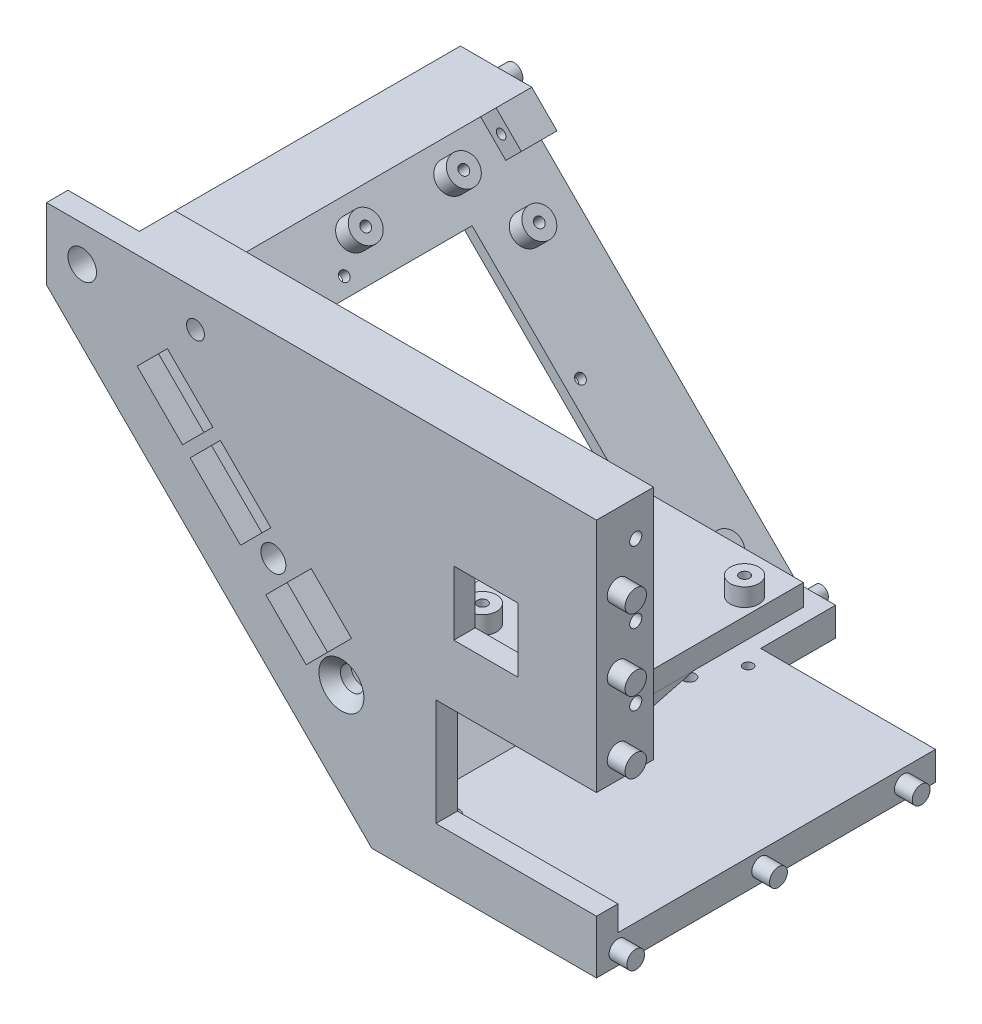
from build123d import *

# Parameters (mm, degrees)
TOP_EXTRUSION_DEPTH                            = 6
MOTHERBOARD_HOLE_SKETCH_W                      = 45
MOTHERBOARD_HOLE_SKETCH_H                      = 30
MOTHERBOARD_HOLE_DEPTH                         = 191.138226036
TOP_HOLES_SKETCH_R                             = 3.5
TOP_HOLES_DEPTH                                = 6
TOP_LEFT_HOLE_SKETCH_R                         = 4
TOP_LEFT_HOLE_DEPTH                            = 191.138226036
VERTICAL_FACE_10MM_EXTRUSION_DEPTH             = 10
FRAISAGE_POUR_VIS_T_TE_FRAIS_E_M31_D           = 3.4
FRAISAGE_POUR_VIS_T_TE_FRAIS_E_M31_DEPTH       = 8
FRAISAGE_POUR_VIS_T_TE_FRAIS_E_M31_CSINK_D     = 6.3
FRAISAGE_POUR_VIS_T_TE_FRAIS_E_M31_CSINK_ANGLE = 90
FIX_SCREW_LINEAR_REPETITION_COUNT              = 3
FIX_SCREW_LINEAR_REPETITION_PITCH              = 20
LEFT_RIGHT_FIX_SKETCH_R                        = 3
LEFT_RIGHT_FIX_SKETCH_R_2                      = 2.5
LEFT_RIGHT_FIX_EXTRUSION_DEPTH                 = 5
FIX_USBBOARD_SKETCH_W                          = 46
FIX_USBBOARD_SKETCH_H                          = 6
FIX_USBBOARD_EXTRUSION_DEPTH                   = 60
USBCONNECTOR_HOLE_SKETCH_W                     = 18
USBCONNECTOR_HOLE_SKETCH_H                     = 18
USBCONNECTOR_HOLE_DEPTH                        = 6
FIX_SCREW_USBBOARD_SKETCH_R                    = 4
FIX_SCREW_USBBOARD_EXTRUSION_DEPTH             = 5
FIX_SCREW_USBBOARD_HOLE_SKETCH_R               = 1.4
FIX_SCREW_USBBOARD_HOLE_DEPTH                  = 11
CONSOLIDATION_EXTRUSION_DEPTH                  = 37
VERTICAL_FACE_EXTRUSION_DEPTH                  = 100
LEFT_VERTICAL_HOLE_SKETCH_W                    = 71
LEFT_VERTICAL_HOLE_SKETCH_H                    = 76.90556621
LEFT_VERTICAL_HOLE_DEPTH                       = 8
LEFT_VERTICAL_GLASS_SKETCH_W                   = 87
LEFT_VERTICAL_GLASS_SKETCH_H                   = 92.90556621
LEFT_VERTICAL_GLASS_HOLE_DEPTH                 = 5
LEFT_VERTICAL_GLASS_FIX_HOLE_SKETCH_R          = 1.35
LEFT_VERTICAL_GLASS_FIX_HOLE_DEPTH             = 3
BOTTOM_FIX_SKETCH_R                            = 2.5
BOTTOM_FIX_SKETCH_R_2                          = 2
BOTTOM_FIX_EXTRUSION_DEPTH                     = 5
BOTTOM_FIX_SCREW_SKETCH_W                      = 10
BOTTOM_FIX_SCREW_SKETCH_H                      = 10
BOTTOM_FIX_SCREW_EXTRUSION_DEPTH               = 6.142136
BOTTOM_FIX_SCREW_HOLE_SKETCH_R                 = 1.35
BOTTOM_FIX_SCREW_HOLE_DEPTH                    = 10
LCDHOLE_SKETCH_W                               = 49
LCDHOLE_SKETCH_H                               = 42
LCDHOLE_DEPTH                                  = 8
LCDSCREW_R                                     = 1.35
LCDSCREW_HOLE_DEPTH                            = 7
ELECTRONICALMAINBOARDFIX_SKETCH_R              = 4
ELECTRONICALMAINBOARDFIX_EXTRUSION_DEPTH       = 5
ELECTRONICALMAINBOARDFIX_HOLE_SKETCH_R         = 1.35
ELECTRONICALMAINBOARDFIX_HOLE_DEPTH            = 7
SCREW_MOTHERBOARDFIX_LINEAR_REPEAT_COUNT       = 2
SCREW_MOTHERBOARDFIX_LINEAR_REPEAT_PITCH       = 66
LEFTFIX_HOLE_REACH                             = 200.399
RIGHTFIX_HOLE_START                            = -16.75
RIGHTFIX_HOLE_DEPTH                            = 16.75
RIGHTFIX_HOLE_START_2                          = -94.978995736
RIGHTFIX_HOLE_2_DEPTH                          = 3.978995736


with BuildPart() as part:
    # Top Sketch → Top-Extrusion (new body)
    with BuildSketch(Plane.XY):
        Polygon((-63, 0), (0, 0), (0, 111.15), (-154.15, 111.15), (-154.15, 91.15), align=None)
    extrude(amount=TOP_EXTRUSION_DEPTH)

    # MotherBoard-Hole-Sketch → MotherBoard-Hole (cut, through all)
    with BuildSketch(Plane.XY.offset(6)):
        with Locations((-22.5, 30)):
            Rectangle(MOTHERBOARD_HOLE_SKETCH_W, MOTHERBOARD_HOLE_SKETCH_H)
    extrude(amount=-MOTHERBOARD_HOLE_DEPTH, mode=Mode.SUBTRACT)

    # Top-Holes-Sketch → Top-Holes (cut)
    with BuildSketch(Plane.XY.offset(6)):
        with Locations((-90.577164466, 56.568542495)):
            Circle(TOP_HOLES_SKETCH_R)
        Polygon((-120.275649276, 92.630988335), (-128.76093065, 84.145706961), (-116.033008589, 71.4177849), (-107.547727215, 79.903066274), align=None)
        Polygon((-113.911688245, 69.296464556), (-99.769552622, 55.154328933), (-91.284271247, 63.639610307), (-105.426406871, 77.781745931), align=None)
        Polygon((-79.970562748, 59.39696962), (-92.69848481, 46.669047558), (-81.384776311, 35.355339059), (-68.656854249, 48.083261121), align=None)
    extrude(amount=-TOP_HOLES_DEPTH, mode=Mode.SUBTRACT)

    # Esquisse20 → Fraisage pour vis à tête fraisée M61 (revolve, cut)
    with BuildSketch(Plane(origin=(-71.5, 35.370057685, 6), x_dir=(0, -1, 0), z_dir=(1, 0, 0))):
        Polygon((0, 0), (0, 6), (3.3, 6), (3.3, 3), (6.3, 0), align=None)
    revolve(axis=Axis((-71.5, 35.370057685, 12.35), (0, 0, -1)), mode=Mode.SUBTRACT)

    # Top-Left-Hole-Sketch → Top-Left-Hole (cut, through all)
    with BuildSketch(Plane.XY.offset(6)):
        with Locations((-144.15, 101.15)):
            Circle(TOP_LEFT_HOLE_SKETCH_R)
    extrude(amount=-TOP_LEFT_HOLE_DEPTH, mode=Mode.SUBTRACT)

    # Vertical-Face-10mm-Sketch → Vertical-Face-10mm-Extrusion (add)
    with BuildSketch(Plane(origin=(0, 0, 0), x_dir=(-1, 0, 0), z_dir=(0, 0, -1))):
        Polygon((90.65, 105.15), (90.65, 91.15), (128.694155877, 91.15), (135.765223689, 84.078932188), (59.686291501, 8), (0, 8), (0, 0), (63, 0), (154.15, 91.15), (134.15, 91.15), (134.15, 111.15), (115.306380703, 111.15), (0, 111.15), (0, 45), (45, 45), (45, 53), (8, 53), (8, 105.15), align=None)
    extrude(amount=VERTICAL_FACE_10MM_EXTRUSION_DEPTH)

    # Fraisage pour vis à tête fraisée M31
    with Locations(Plane.ZY.offset(8)):
        with Locations((-5, 101.15)):
            fraisage_pour_vis_t_te_frais_e_m31 = CounterSinkHole(FRAISAGE_POUR_VIS_T_TE_FRAIS_E_M31_D / 2, FRAISAGE_POUR_VIS_T_TE_FRAIS_E_M31_CSINK_D / 2, depth=FRAISAGE_POUR_VIS_T_TE_FRAIS_E_M31_DEPTH, counter_sink_angle=FRAISAGE_POUR_VIS_T_TE_FRAIS_E_M31_CSINK_ANGLE)

    # Fix-Screw-Linear-Repetition: Fraisage pour vis à tête fraisée M31 ×3
    with Locations(*[(0, -i * FIX_SCREW_LINEAR_REPETITION_PITCH, 0) for i in range(1, FIX_SCREW_LINEAR_REPETITION_COUNT)]):
        add(fraisage_pour_vis_t_te_frais_e_m31, mode=Mode.SUBTRACT)

    # Left-Right-Fix-Sketch → Left-Right-Fix-Extrusion (add)
    with BuildSketch(Plane(origin=(0, 0, 0), x_dir=(0, 0, -1), z_dir=(1, 0, 0))):
        with Locations(Location((0, 71.15, 0), (0, 0, 180))):
            Circle(LEFT_RIGHT_FIX_SKETCH_R)
        with Locations(Location((0, 91.15, 0), (0, 0, 180))):
            Circle(LEFT_RIGHT_FIX_SKETCH_R)
        with Locations(Location((0, 4, 0), (0, 0, 180))):
            Circle(LEFT_RIGHT_FIX_SKETCH_R_2)
        with Locations(Location((0, 51.15, 0), (0, 0, 180))):
            Circle(LEFT_RIGHT_FIX_SKETCH_R)
        with Locations(Location((40, 4, 0), (0, 0, 90))):
            Circle(LEFT_RIGHT_FIX_SKETCH_R_2)
        with Locations(Location((80, 4, 0), (0, 0, 90))):
            Circle(LEFT_RIGHT_FIX_SKETCH_R_2)
    extrude(amount=LEFT_RIGHT_FIX_EXTRUSION_DEPTH)


with BuildPart() as left_right_fix_extrusion_piece_1:
    # of the separate pieces the step leaves, piece 1, a body of its own (left_right_fix_extrusion_pieces)
    add(part.part.solids().sort_by_distance((-63, 0, 6))[0])

    # Fix-UsbBoard-Sketch → Fix-UsbBoard-Extrusion (add)
    with BuildSketch(Plane(origin=(0, 0, 0), x_dir=(-1, 0, 0), z_dir=(0, 0, -1))):
        with Locations((31, 56)):
            Rectangle(FIX_USBBOARD_SKETCH_W, FIX_USBBOARD_SKETCH_H)
    extrude(amount=FIX_USBBOARD_EXTRUSION_DEPTH)

    # UsbConnector-Hole-Sketch → UsbConnector-Hole (cut)
    with BuildSketch(Plane(origin=(0, 0, 0), x_dir=(-1, 0, 0), z_dir=(0, 0, -1))):
        with Locations((31, 71)):
            Rectangle(USBCONNECTOR_HOLE_SKETCH_W, USBCONNECTOR_HOLE_SKETCH_H)
    extrude(amount=-USBCONNECTOR_HOLE_DEPTH, mode=Mode.SUBTRACT)

    # Fix-Screw-UsbBoard-Sketch → Fix-Screw-UsbBoard-Extrusion (add)
    with BuildSketch(Plane(origin=(0, 59, 0), x_dir=(1, 0, 0), z_dir=(0, 1, 0))):
        with Locations(Location((-19, 5, 0), (0, 0, 90))):
            Circle(FIX_SCREW_USBBOARD_SKETCH_R)
        with Locations(Location((-13, 48.5, 0), (0, 0, 90))):
            Circle(FIX_SCREW_USBBOARD_SKETCH_R)
        with Locations(Location((-49, 48.5, 0), (0, 0, 90))):
            Circle(FIX_SCREW_USBBOARD_SKETCH_R)
        with Locations(Location((-43, 5, 0), (0, 0, 90))):
            Circle(FIX_SCREW_USBBOARD_SKETCH_R)
    extrude(amount=FIX_SCREW_USBBOARD_EXTRUSION_DEPTH)

    # Fix-Screw-UsbBoard-Hole-Sketch → Fix-Screw-UsbBoard-Hole (cut)
    with BuildSketch(Plane(origin=(0, 64, 0), x_dir=(1, 0, 0), z_dir=(0, 1, 0))):
        with Locations(Location((-19, 5, 0), (0, 0, 270))):
            Circle(FIX_SCREW_USBBOARD_HOLE_SKETCH_R)
        with Locations(Location((-43, 5, 0), (0, 0, 270))):
            Circle(FIX_SCREW_USBBOARD_HOLE_SKETCH_R)
        with Locations(Location((-13, 48.5, 0), (0, 0, 270))):
            Circle(FIX_SCREW_USBBOARD_HOLE_SKETCH_R)
        with Locations(Location((-49, 48.5, 0), (0, 0, 270))):
            Circle(FIX_SCREW_USBBOARD_HOLE_SKETCH_R)
    extrude(amount=-FIX_SCREW_USBBOARD_HOLE_DEPTH, mode=Mode.SUBTRACT)



with BuildPart() as left_right_fix_extrusion_piece_2:
    # of the separate pieces the step leaves, piece 2, a body of its own (left_right_fix_extrusion_pieces)
    add(part.part.solids().sort_by_distance((0, 6.5, -80))[0])


with BuildPart() as left_right_fix_extrusion_piece_3:
    # of the separate pieces the step leaves, piece 3, a body of its own (left_right_fix_extrusion_pieces)
    add(part.part.solids().sort_by_distance((0, 6.5, -40))[0])


with BuildPart() as body_4:
    # Consolidation-Sketch → Consolidation-Extrusion (new body)
    with BuildSketch(Plane(origin=(-8, 0, 0), x_dir=(0, 0, -1), z_dir=(1, 0, 0))):
        Polygon((10, 48), (29.364916731, 53), (10, 53), align=None)
    extrude(amount=-CONSOLIDATION_EXTRUSION_DEPTH)


with BuildPart() as left_right_fix_extrusion_piece_1_1:
    add(left_right_fix_extrusion_piece_1.part)

    add(left_right_fix_extrusion_piece_3.part)  # Vertical-Face-Extrusion merges Left-Right-Fix-Extrusion piece 3
    # Vertical-Face-Sketch → Vertical-Face-Extrusion (add)
    with BuildSketch(Plane(origin=(0, 0, -10), x_dir=(-1, 0, 0), z_dir=(0, 0, -1))):
        Polygon((0, 8), (59.686291501, 8), (138.493145751, 86.806854249), (134.15, 91.15), (154.15, 91.15), (63, 0), (0, 0), align=None)
    extrude(amount=VERTICAL_FACE_EXTRUSION_DEPTH)

    # Left-Vertical-Hole-Sketch → Left-Vertical-Hole (cut)
    with BuildSketch(Plane(origin=(-31.5, -31.5, 0), x_dir=(0, 0, 1), z_dir=(-0.7071067811865485, -0.7071067811865467, 0))):
        with Locations((-49.5, 103.00051032)):
            Rectangle(LEFT_VERTICAL_HOLE_SKETCH_W, LEFT_VERTICAL_HOLE_SKETCH_H)
    extrude(amount=-LEFT_VERTICAL_HOLE_DEPTH, mode=Mode.SUBTRACT)

    # Left-Vertical-Glass-Sketch → Left-Vertical-Glass-Hole (cut)
    with BuildSketch(Plane(origin=(-31.5, -31.5, 0), x_dir=(0, 0, 1), z_dir=(-0.7071067811865485, -0.7071067811865467, 0))):
        with Locations((-49.5, 103.00051032)):
            Rectangle(LEFT_VERTICAL_GLASS_SKETCH_W, LEFT_VERTICAL_GLASS_SKETCH_H)
    extrude(amount=-LEFT_VERTICAL_GLASS_HOLE_DEPTH, mode=Mode.SUBTRACT)

    # Left-Vertical-Glass-Fix-Hole-Sketch → Left-Vertical-Glass-Fix-Hole (cut)
    with BuildSketch(Plane(origin=(-27.964466094, -27.964466094, 0), x_dir=(0, 0, 1), z_dir=(-0.7071067811865482, -0.7071067811865468, 0))):
        with Locations(Location((-10, 104.453293425, 0), (0, 0, 270))):
            Circle(LEFT_VERTICAL_GLASS_FIX_HOLE_SKETCH_R)
        with Locations(Location((-89.198071347, 104.453293425, 0), (0, 0, 270))):
            Circle(LEFT_VERTICAL_GLASS_FIX_HOLE_SKETCH_R)
        with Locations(Location((-52, 60.547727215, 0), (0, 0, 270))):
            Circle(LEFT_VERTICAL_GLASS_FIX_HOLE_SKETCH_R)
        with Locations(Location((-52, 145.453293425, 0), (0, 0, 270))):
            Circle(LEFT_VERTICAL_GLASS_FIX_HOLE_SKETCH_R)
    extrude(amount=-LEFT_VERTICAL_GLASS_FIX_HOLE_DEPTH, mode=Mode.SUBTRACT)

    # Bottom-Fix-Sketch → Bottom-Fix-Extrusion (add)
    with BuildSketch(Plane(origin=(0, 0, -110), x_dir=(-1, 0, 0), z_dir=(0, 0, -1))):
        with Locations(Location((144.15, 87.15, 0), (0, 0, 180))):
            Circle(BOTTOM_FIX_SKETCH_R)
        with Locations(Location((5, 4, 0), (0, 0, 180))):
            Circle(BOTTOM_FIX_SKETCH_R_2)
        with Locations(Location((58, 4, 0), (0, 0, 180))):
            Circle(BOTTOM_FIX_SKETCH_R_2)
    extrude(amount=BOTTOM_FIX_EXTRUSION_DEPTH)

    # Bottom-Fix-Screw-Sketch → Bottom-Fix-Screw-Extrusion (add)
    with BuildSketch(Plane(origin=(-25.843145751, -25.843145751, 0), x_dir=(0, 0, -1), z_dir=(0.7071067811865477, 0.7071067811865475, 0))):
        with Locations((105, 154.311157801)):
            Rectangle(BOTTOM_FIX_SCREW_SKETCH_W, BOTTOM_FIX_SCREW_SKETCH_H)
    extrude(amount=BOTTOM_FIX_SCREW_EXTRUSION_DEPTH)

    # Bottom-Fix-Screw-Hole-Sketch → Bottom-Fix-Screw-Hole (cut)
    with BuildSketch(Plane(origin=(0, 0, -110), x_dir=(-1, 0, 0), z_dir=(0, 0, -1))):
        with Locations((132.735786438, 85.493145751)):
            Circle(BOTTOM_FIX_SCREW_HOLE_SKETCH_R)
    extrude(amount=-BOTTOM_FIX_SCREW_HOLE_DEPTH, mode=Mode.SUBTRACT)

    # Esquisse23 → Fraisage pour vis à tête fraisée M33 (revolve, cut)
    with BuildSketch(Plane(origin=(-103.240276001, 44.482916688, -93), x_dir=(0, -1, 0), z_dir=(1, 0, 0))):
        Polygon((0, 0), (0, 22), (1.7, 22), (1.7, 1.05), (2.75, 0), align=None)
    revolve(axis=Axis((-103.240276001, 44.482916688, -86.65), (0, 0, -1)), mode=Mode.SUBTRACT)

    # LcdHole-Sketch → LcdHole (cut)
    with BuildSketch(Plane.XZ):
        with Locations((-24.5, -110)):
            Rectangle(LCDHOLE_SKETCH_W, LCDHOLE_SKETCH_H)
    extrude(amount=-LCDHOLE_DEPTH, mode=Mode.SUBTRACT)

    # LcdScrew → LcdScrew-Hole (cut)
    with BuildSketch(Plane(origin=(0, 8, 0), x_dir=(1, 0, 0), z_dir=(0, 1, 0))):
        with Locations(Location((-46.5, 83, 0), (0, 0, 180))):
            Circle(LCDSCREW_R)
    extrude(amount=-LCDSCREW_HOLE_DEPTH, mode=Mode.SUBTRACT)

    # ElectronicalMainBoardFix-Sketch → ElectronicalMainBoardFix-Extrusion (add)
    with BuildSketch(Plane(origin=(-25.843145751, -25.843145751, 0), x_dir=(0.7071067811865475, -0.7071067811865477, 0), z_dir=(0.7071067811865477, 0.7071067811865475, 0))):
        with Locations((-151.861435714, 19.5)):
            Circle(ELECTRONICALMAINBOARDFIX_SKETCH_R)
        with Locations((-151.861435714, 59)):
            Circle(ELECTRONICALMAINBOARDFIX_SKETCH_R)
        with Locations((-151.861435714, 86.5)):
            Circle(ELECTRONICALMAINBOARDFIX_SKETCH_R)
        with Locations((-57.861435714, 12.5)):
            Circle(ELECTRONICALMAINBOARDFIX_SKETCH_R)
        with Locations(Location((-63.361435714, 86.5, 0), (0, 0, 252.748122151))):
            Circle(ELECTRONICALMAINBOARDFIX_SKETCH_R)
        with Locations((-57.861435714, 58.5)):
            Circle(ELECTRONICALMAINBOARDFIX_SKETCH_R)
        with Locations((-60.861435714, 96)):
            Circle(ELECTRONICALMAINBOARDFIX_SKETCH_R)
        with Locations((-135.361435714, 96)):
            Circle(ELECTRONICALMAINBOARDFIX_SKETCH_R)
    extrude(amount=ELECTRONICALMAINBOARDFIX_EXTRUSION_DEPTH)

    # ElectronicalMainBoardFix-Hole-Sketch → ElectronicalMainBoardFix-Hole (cut)
    with BuildSketch(Plane(origin=(-22.307611845, -22.307611845, 0), x_dir=(0, 0, -1), z_dir=(0.7071067811865476, 0.7071067811865476, 0))):
        with Locations(Location((19.5, 151.861435714, 0), (0, 0, 90))):
            Circle(ELECTRONICALMAINBOARDFIX_HOLE_SKETCH_R)
        with Locations(Location((59, 151.861435714, 0), (0, 0, 90))):
            Circle(ELECTRONICALMAINBOARDFIX_HOLE_SKETCH_R)
        with Locations(Location((86.5, 151.861435714, 0), (0, 0, 90))):
            Circle(ELECTRONICALMAINBOARDFIX_HOLE_SKETCH_R)
        with Locations(Location((12.5, 57.861435714, 0), (0, 0, 90))):
            Circle(ELECTRONICALMAINBOARDFIX_HOLE_SKETCH_R)
        with Locations(Location((58.5, 57.861435714, 0), (0, 0, 90))):
            Circle(ELECTRONICALMAINBOARDFIX_HOLE_SKETCH_R)
        with Locations(Location((86.5, 63.361435714, 0), (0, 0, 90))):
            Circle(ELECTRONICALMAINBOARDFIX_HOLE_SKETCH_R)
        with Locations(Location((96, 60.861435714, 0), (0, 0, 90))):
            Circle(ELECTRONICALMAINBOARDFIX_HOLE_SKETCH_R)
        with Locations(Location((96, 135.361435714, 0), (0, 0, 90))):
            Circle(ELECTRONICALMAINBOARDFIX_HOLE_SKETCH_R)
    extrude(amount=-ELECTRONICALMAINBOARDFIX_HOLE_DEPTH, mode=Mode.SUBTRACT)

    # Esquisse27 → Screw-MotherBoard (revolve, cut)
    with BuildSketch(Plane(origin=(-52, 0, -72), x_dir=(0, 0, -1), z_dir=(1, 0, 0))):
        Polygon((0, 0), (0, 8), (1.7, 8), (1.7, 1.45), (3.15, 0), align=None)
    screw_motherboard = revolve(axis=Axis((-52, -6.35, -72), (0, 1, 0)), mode=Mode.SUBTRACT)

    # Screw-MotherBoardFix-Linear-Repeat: Screw-MotherBoard ×2
    with Locations(*[(0, 0, i * SCREW_MOTHERBOARDFIX_LINEAR_REPEAT_PITCH) for i in range(1, SCREW_MOTHERBOARDFIX_LINEAR_REPEAT_COUNT)]):
        add(screw_motherboard, mode=Mode.SUBTRACT)

    # LeftFix-Hole: up to this plane
    leftfix_hole_end = Plane(origin=(-117.998590449, 0, 31.617627019), z_dir=(-0.9659258262890681, 0, 0.25881904510252135))
    # LeftFixHole-Sketch → LeftFix-Hole (cut, up to the surface)
    with BuildSketch(Plane.ZY.offset(112.4), mode=Mode.PRIVATE) as leftfix_hole_sk1:
        Polygon((-10, 108.65), (-10, 93.65), (0, 96.329491924), (0, 105.970508076), align=None)
    leftfix_hole_tool1 = split(extrude(leftfix_hole_sk1.sketch, amount=LEFTFIX_HOLE_REACH, mode=Mode.PRIVATE), bisect_by=leftfix_hole_end, keep=Keep.BOTH, mode=Mode.PRIVATE)
    add(leftfix_hole_tool1.solids().sort_by_distance((-112.4, 101.15, -5.36247))[0], mode=Mode.SUBTRACT)

    # RightFix-Hole: read off the stored shape, not the designer's step
    # RightFix-Hole outline → RightFix-Hole (cut)
    with BuildSketch(Plane.ZY.offset(112.4).offset(RIGHTFIX_HOLE_START)):
        Polygon((0, 96.329491924), (0, 105.970508076), (-10, 108.65), (-10, 93.65), align=None)
    extrude(amount=RIGHTFIX_HOLE_DEPTH, mode=Mode.SUBTRACT)

    # RightFix-Hole 2 outline → RightFix-Hole 2 (add)
    with BuildSketch(Plane(origin=(0, 0, 0), x_dir=(0, 1, 0), z_dir=(0.9659258262890682, 0, 0.2588190451025211)).offset(RIGHTFIX_HOLE_START_2)):
        Polygon((96.329491924, 25.449545205), (93.65, 15.096783401), (108.65, 15.096783401), (105.970508076, 25.449545205), align=None)
    extrude(amount=RIGHTFIX_HOLE_2_DEPTH)

    # MainFix-Hole-Sketch → MainFix-Hole-Revolution (revolve, cut)
    with BuildSketch(Plane.ZY.offset(112.4), mode=Mode.PRIVATE) as mainfix_hole_revolution_sk:
        Polygon((6, 101.15), (0, 101.15), (0, 105.15), (6, 103.65), align=None)
    revolve(mainfix_hole_revolution_sk.sketch.rotate(Axis((-112.4, 101.15, 0.5), (0, 0, -1)), 90), axis=Axis((-112.4, 101.15, 0.5), (0, 0, -1)), mode=Mode.SUBTRACT)


solid = Compound([left_right_fix_extrusion_piece_2.part, body_4.part, left_right_fix_extrusion_piece_1_1.part])
